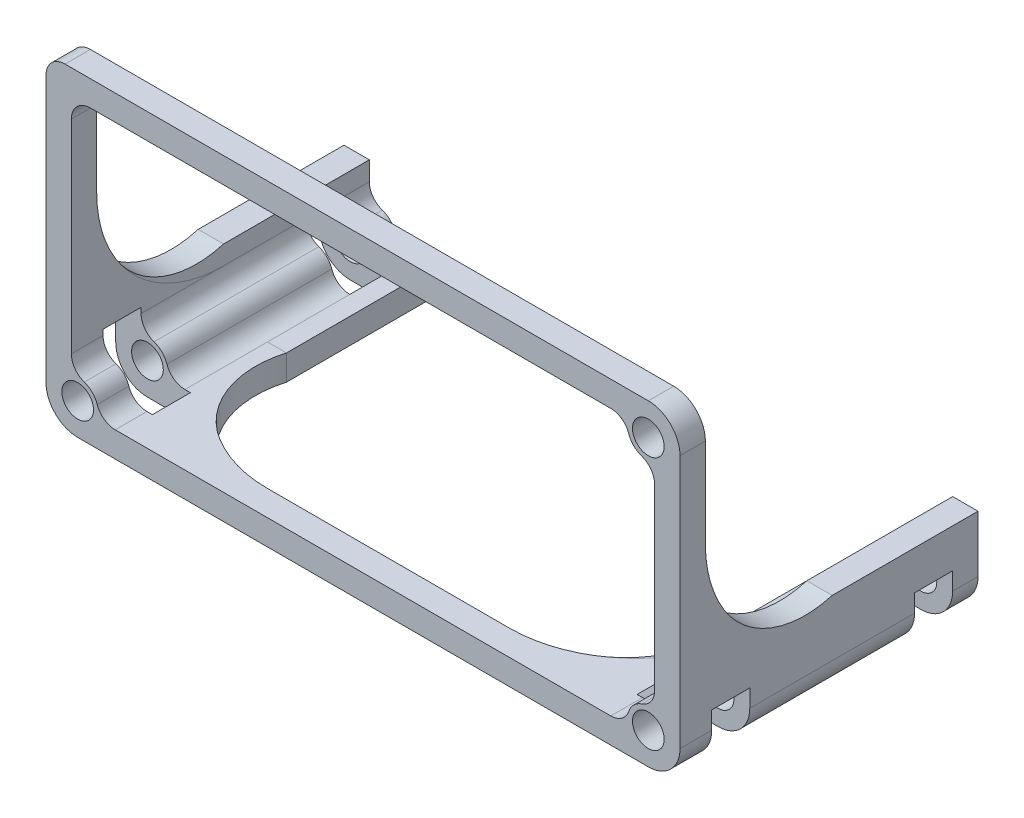
from build123d import *

# Parameters (mm, degrees)
SKETCH1_R           = 2.5
BOSS_EXTRUDE2_DEPTH = 4
FILLET1_R           = 5
FILLET2_R           = 3
FILLET3_R           = 3
BOSS_EXTRUDE3_START = -47
SKETCH2_R           = 2.5
BOSS_EXTRUDE3_DEPTH = 47
FILLET4_R           = 20
CUT_EXTRUDE1_REACH  = 115.914
SKETCH3_W           = 6
SKETCH3_H           = 11
SKETCH4_W           = 4
SKETCH4_H           = 23
BOSS_EXTRUDE4_DEPTH = 3
FILLET5_START       = -50
FILLET5_DEPTH       = 4
FILLET5_START_2     = 46
FILLET5_2_DEPTH     = 4
SKETCH5_W           = 23
SKETCH5_H           = 4
BOSS_EXTRUDE5_DEPTH = 3
FILLET6_START       = -25
FILLET6_DEPTH       = 4
SKETCH6_W           = 23
SKETCH6_H           = 4
BOSS_EXTRUDE6_DEPTH = 3
FILLET7_START       = -25
FILLET7_DEPTH       = 4


with BuildPart() as part:
    # Sketch1 → Boss-Extrude2 (new body)
    with BuildSketch(Plane.XY):
        Polygon((-50, -25), (-41.75, -25), (41.75, -25), (50, -25), (50, -16.75), (50, 16.75), (50, 25), (41.75, 25), (-50, 25), (-50, -16.75), align=None)
        with Locations((-45, -20)):
            Circle(SKETCH1_R, mode=Mode.SUBTRACT)
        with Locations((45, -20)):
            Circle(SKETCH1_R, mode=Mode.SUBTRACT)
        with BuildLine():
            Line((-45, -16.75), (-46, -16.75))
            Line((-46, -16.75), (-46, 21))
            Line((-46, 21), (41.75, 21))
            Line((41.75, 21), (41.75, 20))
            ThreePointArc((41.75, 20), (42.701902961, 17.701902961), (45, 16.75))
            Line((45, 16.75), (46, 16.75))
            Line((46, 16.75), (46, -16.75))
            Line((46, -16.75), (45, -16.75))
            ThreePointArc((45, -16.75), (42.701902961, -17.701902961), (41.75, -20))
            Line((41.75, -20), (41.75, -21))
            Line((41.75, -21), (-41.75, -21))
            Line((-41.75, -21), (-41.75, -20))
            ThreePointArc((-41.75, -20), (-42.701902961, -17.701902961), (-45, -16.75))
        make_face(mode=Mode.SUBTRACT)
        with Locations((45, 20)):
            Circle(SKETCH1_R, mode=Mode.SUBTRACT)
    extrude(amount=BOSS_EXTRUDE2_DEPTH)

    # Fillet1
    fillet1_edges = [part.edges().sort_by_distance(p)[0] for p in [
        (50, 25, 2),
        (50, -25, 2),
        (-50, -25, 2),
    ]]
    fillet(fillet1_edges, radius=FILLET1_R)

    # Fillet2
    fillet2_edges = [part.edges().sort_by_distance(p)[0] for p in [
        (41.75, 21, 2),
        (46, 16.75, 2),
        (46, -16.75, 2),
        (41.75, -21, 2),
        (-41.75, -21, 2),
        (-46, -16.75, 2),
    ]]
    fillet(fillet2_edges, radius=FILLET2_R)

    # Fillet3
    fillet3_edges = [part.edges().sort_by_distance(p)[0] for p in [
        (-46, 21, 2),
        (-50, 25, 2),
    ]]
    fillet(fillet3_edges, radius=FILLET3_R)

    # Sketch2 → Boss-Extrude3 (add)
    # profile 1 of 2: a face of its own
    with BuildSketch(Plane.XY.offset(4).offset(BOSS_EXTRUDE3_START)):
        with BuildLine():
            Line((-46, -14.078640359), (-50, -14.078640359))
            Line((-50, -14.078640359), (-50, -16.75))
            Line((-50, -16.75), (-50, -20))
            ThreePointArc((-50, -20), (-48.535533906, -23.535533906), (-45, -25))
            Line((-45, -25), (-41.75, -25))
            Line((-41.75, -25), (-39.078640359, -25))
            Line((-39.078640359, -25), (-39.078640359, -21))
            ThreePointArc((-39.078640359, -21), (-40.827925927, -20.437211521), (-41.920892987, -18.96))
            ThreePointArc((-41.920892987, -18.96), (-42.701902961, -17.701902961), (-43.96, -16.920892987))
            ThreePointArc((-43.96, -16.920892987), (-45.437211521, -15.827925927), (-46, -14.078640359))
        make_face()
        with Locations((-45, -20)):
            Circle(SKETCH2_R, mode=Mode.SUBTRACT)
    # profile 2 of 2: a face of its own
    with BuildSketch(Plane.XY.offset(4).offset(BOSS_EXTRUDE3_START)):
        with BuildLine():
            Line((39.078640359, -21), (39.078640359, -25))
            Line((39.078640359, -25), (45, -25))
            ThreePointArc((45, -25), (48.535533906, -23.535533906), (50, -20))
            Line((50, -20), (50, -14.078640359))
            Line((50, -14.078640359), (46, -14.078640359))
            ThreePointArc((46, -14.078640359), (45.437211521, -15.827925927), (43.96, -16.920892987))
            ThreePointArc((43.96, -16.920892987), (42.701902961, -17.701902961), (41.920892987, -18.96))
            ThreePointArc((41.920892987, -18.96), (40.827925927, -20.437211521), (39.078640359, -21))
        make_face()
        with Locations((45, -20)):
            Circle(SKETCH2_R, mode=Mode.SUBTRACT)
    extrude(amount=BOSS_EXTRUDE3_DEPTH)

    # Fillet4
    # the kernel refuses this fillet: 20 mm, written as the material it adds along each edge
    with BuildSketch(Plane(origin=(-50, -14.078640359, 0), x_dir=(0, 1, 0), z_dir=(1, 0, 0)), Plane(origin=(39.078640359, -25, 0), x_dir=(-1, 0, 0), z_dir=(0, 1, 0))) as fillet4_piece_1:
        with BuildLine():
            CenterArc((FILLET4_R, -FILLET4_R), FILLET4_R, 90, 90)
            Line((0, -FILLET4_R), (0, 0))
            Line((0, 0), (FILLET4_R, 0))
        make_face()
    extrude(amount=4)
    with BuildSketch(Plane(origin=(-39.078640359, -21, 0), x_dir=(0, 0, -1), z_dir=(0, -1, 0)), Plane(origin=(46, -14.078640359, 0), x_dir=(0, 0, -1), z_dir=(1, 0, 0))) as fillet4_piece_2:
        with BuildLine():
            CenterArc((FILLET4_R, FILLET4_R), FILLET4_R, 180, 90)
            Line((0, FILLET4_R), (0, 0))
            Line((0, 0), (FILLET4_R, 0))
        make_face()
    extrude(amount=4)

    # Sketch3 → Cut-Extrude1 (cut, up to next)
    with BuildSketch(Plane(origin=(-36.035533906, -36.035533906, 0), x_dir=(0, 0, -1), z_dir=(0.707106781186548, 0.7071067811865471, 0)), mode=Mode.PRIVATE) as cut_extrude1_sk1:
        with Locations((4, 17.67766953)):
            Rectangle(SKETCH3_W, SKETCH3_H)
    cut_extrude1_tool1 = extrude(cut_extrude1_sk1.sketch, amount=CUT_EXTRUDE1_REACH, mode=Mode.PRIVATE) & part.part
    # Sketch3 → Cut-Extrude1 (cut, up to next)
    with BuildSketch(Plane(origin=(-36.035533906, -36.035533906, 0), x_dir=(0, 0, -1), z_dir=(0.707106781186548, 0.7071067811865471, 0)), mode=Mode.PRIVATE) as cut_extrude1_sk2:
        with Locations((36, 17.67766953)):
            Rectangle(SKETCH3_W, SKETCH3_H)
    cut_extrude1_tool2 = extrude(cut_extrude1_sk2.sketch, amount=CUT_EXTRUDE1_REACH, mode=Mode.PRIVATE) & part.part
    cut_extrude1_1 = cut_extrude1_tool1.solids().sort_by_distance((-48.535534, -23.535534, -4))[0]
    add(cut_extrude1_1, mode=Mode.SUBTRACT)
    cut_extrude1_2 = cut_extrude1_tool2.solids().sort_by_distance((-48.535534, -23.535534, -36))[0]
    add(cut_extrude1_2, mode=Mode.SUBTRACT)
    cut_extrude1 = cut_extrude1_1 + cut_extrude1_2  # Cut-Extrude1 as one shape, for the pattern or mirror that repeats it

    # Mirror1: Cut-Extrude1 across plane
    add(cut_extrude1.mirror(Plane(origin=(0, 0, 0), x_dir=(0, 0, 1), z_dir=(1, 0, 0))), mode=Mode.SUBTRACT)

    # Sketch4 → Boss-Extrude4 (add)
    with BuildSketch(Plane(origin=(0, -14.078640359, 0), x_dir=(1, 0, 0), z_dir=(0, 1, 0))):
        with Locations((-48, 31.5)):
            Rectangle(SKETCH4_W, SKETCH4_H)
        with Locations((48, 31.5)):
            Rectangle(SKETCH4_W, SKETCH4_H)
    extrude(amount=BOSS_EXTRUDE4_DEPTH)

    # Fillet5: read off the stored shape, not the designer's step
    # Fillet5 outline → Fillet5 (add)
    with BuildSketch(Plane.YZ.offset(FILLET5_START)):
        with BuildLine():
            ThreePointArc((-11.078640359, -20), (-10.703206123, -10.372818577), (-4.549228594, -2.959847946))
            ThreePointArc((-4.549228594, -2.959847946), (-11.534466961, -10.238129398), (-14.078640359, -20))
            Line((-14.078640359, -20), (-11.078640359, -20))
        make_face()
    extrude(amount=FILLET5_DEPTH)

    # Fillet5 2 outline → Fillet5 2 (add)
    with BuildSketch(Plane.YZ.offset(FILLET5_START_2)):
        with BuildLine():
            ThreePointArc((-11.078640359, -20), (-10.703206123, -10.372818577), (-4.549228594, -2.959847946))
            ThreePointArc((-4.549228594, -2.959847946), (-11.534466961, -10.238129398), (-14.078640359, -20))
            Line((-14.078640359, -20), (-11.078640359, -20))
        make_face()
    extrude(amount=FILLET5_2_DEPTH)

    # Sketch5 → Boss-Extrude5 (add)
    with BuildSketch(Plane(origin=(-39.078640359, 0, 0), x_dir=(0, 0, -1), z_dir=(1, 0, 0))):
        with Locations((31.5, -23)):
            Rectangle(SKETCH5_W, SKETCH5_H)
    extrude(amount=BOSS_EXTRUDE5_DEPTH)

    # Fillet6: read off the stored shape, not the designer's step
    # Fillet6 outline → Fillet6 (add)
    with BuildSketch(Plane(origin=(0, 0, 0), x_dir=(1, 0, 0), z_dir=(0, 1, 0)).offset(FILLET6_START)):
        with BuildLine():
            ThreePointArc((-39.078640359, 20), (-36.534466961, 10.238129398), (-29.549228594, 2.959847946))
            ThreePointArc((-29.549228594, 2.959847946), (-35.703206123, 10.372818577), (-36.078640359, 20))
            Line((-36.078640359, 20), (-39.078640359, 20))
        make_face()
    extrude(amount=FILLET6_DEPTH)

    # Sketch6 → Boss-Extrude6 (add)
    with BuildSketch(Plane.ZY.offset(-39.078640359)):
        with Locations((-31.5, -23)):
            Rectangle(SKETCH6_W, SKETCH6_H)
    extrude(amount=BOSS_EXTRUDE6_DEPTH)

    # Fillet7: read off the stored shape, not the designer's step
    # Fillet7 outline → Fillet7 (add)
    with BuildSketch(Plane(origin=(0, 0, 0), x_dir=(1, 0, 0), z_dir=(0, 1, 0)).offset(FILLET7_START)):
        with BuildLine():
            ThreePointArc((36.078640359, 20), (35.703206123, 10.372818577), (29.549228594, 2.959847946))
            ThreePointArc((29.549228594, 2.959847946), (36.534466961, 10.238129398), (39.078640359, 20))
            Line((39.078640359, 20), (36.078640359, 20))
        make_face()
    extrude(amount=FILLET7_DEPTH)


solid = part.part
